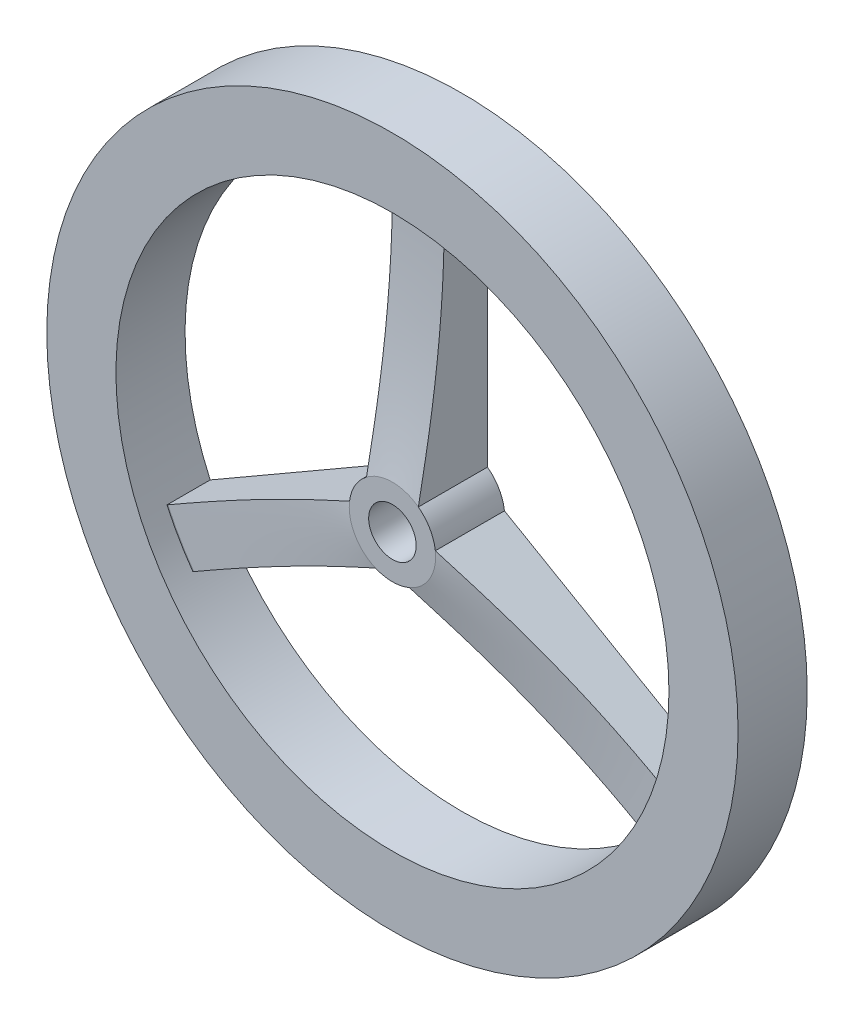
from build123d import *
from build123d.topology import SkipClean

# Parameters (mm, degrees)
SKETCH1_R            = 40
SKETCH1_R_2          = 32
SKETCH1_R_3          = 5
BOSS_EXTRUDE1_DEPTH  = 4
SKETCH3_R            = 32
SKETCH3_R_2          = 5
CUT_EXTRUDE2_DEPTH   = 3
FILLET5_R            = 122
M5_CLEARANCE_HOLE1_D = 5.5


with BuildPart() as part:
    # Sketch1 → Boss-Extrude1 (new, symmetric)
    # profile 1 of 5: a face of its own
    with BuildSketch(Plane.XY):
        Circle(SKETCH1_R)
        Circle(SKETCH1_R_2, mode=Mode.SUBTRACT)
    # profile 2 of 5: a face of its own
    with BuildSketch(Plane.XY):
        with BuildLine():
            Line((-3, 31.859064644), (-3, 4))
            ThreePointArc((-3, 4), (0, 5), (3, 4))
            Line((3, 4), (3, 31.859064644))
            ThreePointArc((3, 31.859064644), (0, 32), (-3, 31.859064644))
        make_face()
    # profile 3 of 5: a face of its own
    with BuildSketch(Plane.XY):
        Circle(SKETCH1_R_3)
    # profile 4 of 5: a face of its own
    with BuildSketch(Plane.XY):
        with BuildLine():
            Line((29.090759323, -13.331456111), (4.964101615, 0.598076211))
            ThreePointArc((4.964101615, 0.598076211), (4.991017335, 0.299576304), (5, 0))
            ThreePointArc((5, 0), (4.172559651, -2.754949357), (1.964101615, -4.598076211))
            Line((1.964101615, -4.598076211), (26.090759323, -18.527608533))
            ThreePointArc((26.090759323, -18.527608533), (27.712812921, -16), (29.090759323, -13.331456111))
        make_face()
    # profile 5 of 5: a face of its own
    with BuildSketch(Plane.XY):
        with BuildLine():
            ThreePointArc((-1.964101615, -4.598076211), (-4.330127019, -2.5), (-4.964101615, 0.598076211))
            Line((-4.964101615, 0.598076211), (-29.090759323, -13.331456111))
            ThreePointArc((-29.090759323, -13.331456111), (-27.712812921, -16), (-26.090759323, -18.527608533))
            Line((-26.090759323, -18.527608533), (-1.964101615, -4.598076211))
        make_face()
    extrude(amount=BOSS_EXTRUDE1_DEPTH, both=True)

    # Sketch3 → Cut-Extrude2 (cut)
    with SkipClean():  # the faces are left unmerged after this step: merging them gives an invalid solid
        with BuildSketch(Plane.XY.offset(4)):
            with Locations(Location((0, 0, 0), (0, 0, 204.620621009))):
                Circle(SKETCH3_R)
            with Locations(Location((0, 0, 0), (0, 0, 173.130102354))):
                Circle(SKETCH3_R_2, mode=Mode.SUBTRACT)
        extrude(amount=-CUT_EXTRUDE2_DEPTH, mode=Mode.SUBTRACT)

    # Fillet5
    # the kernel refuses this fillet: 122 mm, written as the material it adds along each edge
    with BuildSketch(Plane(origin=(0, 0, 1), x_dir=(0.8644503363816339, 0.5027182271707281, 0), z_dir=(0.5027182271707281, -0.8644503363816339, 0))) as fillet5_piece_1_section:
        with BuildLine():
            CenterArc((31.888659319, 122), FILLET5_R, 257.267539737, 12.732460263)
            Line((31.888659319, 0), (5, 0))
            Line((5, 0), (5, 3))
        make_face()
    fillet5_piece_1 = revolve(axis=Axis((0, 0, 1), (0, 0, 1)), revolution_arc=359.64, mode=Mode.PRIVATE)
    fillet5_piece_1 = split(fillet5_piece_1, bisect_by=Plane(origin=(3, 0, 1), z_dir=(-1, 0, 0)), keep=Keep.TOP, mode=Mode.PRIVATE)
    fillet5_piece_1 = split(fillet5_piece_1, bisect_by=Plane(origin=(-1.5, 2.598076211, 1), z_dir=(0.5000000000000004, -0.8660254037844384, 0)), keep=Keep.TOP, mode=Mode.PRIVATE)
    fillet5_piece_1 = split(fillet5_piece_1, bisect_by=Plane(origin=(-1.5, -2.598076211, 1), z_dir=(0.49999999999999983, 0.8660254037844387, 0)), keep=Keep.TOP, mode=Mode.PRIVATE)
    add(fillet5_piece_1)
    with BuildSketch(Plane(origin=(0, 0, 1), x_dir=(0.8644503363816339, 0.5027182271707281, 0), z_dir=(0.5027182271707281, -0.8644503363816339, 0))) as fillet5_piece_2_section:
        with BuildLine():
            CenterArc((31.888659319, 122), FILLET5_R, 257.267539737, 12.732460263)
            Line((31.888659319, 0), (5, 0))
            Line((5, 0), (5, 3))
        make_face()
    fillet5_piece_2 = revolve(axis=Axis((0, 0, 1), (0, 0, 1)), revolution_arc=359.64, mode=Mode.PRIVATE)
    fillet5_piece_2 = split(fillet5_piece_2, bisect_by=Plane(origin=(3, 0, 1), z_dir=(-1, 0, 0)), keep=Keep.TOP, mode=Mode.PRIVATE)
    fillet5_piece_2 = split(fillet5_piece_2, bisect_by=Plane(origin=(-3, 0, 1), z_dir=(1, 0, 0)), keep=Keep.TOP, mode=Mode.PRIVATE)
    fillet5_piece_2 = split(fillet5_piece_2, bisect_by=Plane(origin=(1.5, -2.598076211, 1), z_dir=(-0.5000000000000003, 0.8660254037844385, 0)), keep=Keep.TOP, mode=Mode.PRIVATE)
    add(fillet5_piece_2)
    with BuildSketch(Plane(origin=(0, 0, 1), x_dir=(0.8644503363816339, 0.5027182271707281, 0), z_dir=(0.5027182271707281, -0.8644503363816339, 0))) as fillet5_piece_3_section:
        with BuildLine():
            CenterArc((31.888659319, 122), FILLET5_R, 257.267539737, 12.732460263)
            Line((31.888659319, 0), (5, 0))
            Line((5, 0), (5, 3))
        make_face()
    fillet5_piece_3 = revolve(axis=Axis((0, 0, 1), (0, 0, 1)), revolution_arc=359.64, mode=Mode.PRIVATE)
    fillet5_piece_3 = split(fillet5_piece_3, bisect_by=Plane(origin=(1.5, 2.598076211, 1), z_dir=(-0.49999999999999983, -0.8660254037844387, 0)), keep=Keep.TOP, mode=Mode.PRIVATE)
    fillet5_piece_3 = split(fillet5_piece_3, bisect_by=Plane(origin=(-1.5, 2.598076211, 1), z_dir=(0.5000000000000004, -0.8660254037844384, 0)), keep=Keep.TOP, mode=Mode.PRIVATE)
    fillet5_piece_3 = split(fillet5_piece_3, bisect_by=Plane(origin=(1.5, -2.598076211, 1), z_dir=(-0.5000000000000003, 0.8660254037844385, 0)), keep=Keep.TOP, mode=Mode.PRIVATE)
    add(fillet5_piece_3)
    with BuildSketch(Plane(origin=(0, 0, 1), x_dir=(0.8644503363816339, 0.5027182271707281, 0), z_dir=(0.5027182271707281, -0.8644503363816339, 0))) as fillet5_piece_4_section:
        with BuildLine():
            CenterArc((31.888659319, 122), FILLET5_R, 257.267539737, 12.732460263)
            Line((31.888659319, 0), (5, 0))
            Line((5, 0), (5, 3))
        make_face()
    fillet5_piece_4 = revolve(axis=Axis((0, 0, 1), (0, 0, 1)), revolution_arc=359.64, mode=Mode.PRIVATE)
    fillet5_piece_4 = split(fillet5_piece_4, bisect_by=Plane(origin=(1.5, 2.598076211, 1), z_dir=(-0.49999999999999983, -0.8660254037844387, 0)), keep=Keep.TOP, mode=Mode.PRIVATE)
    fillet5_piece_4 = split(fillet5_piece_4, bisect_by=Plane(origin=(1.5, -2.598076211, 1), z_dir=(0.5000000000000003, -0.8660254037844385, 0)), keep=Keep.TOP, mode=Mode.PRIVATE)
    fillet5_piece_4 = split(fillet5_piece_4, bisect_by=Plane(origin=(-1.5, -2.598076211, 1), z_dir=(0.49999999999999983, 0.8660254037844387, 0)), keep=Keep.TOP, mode=Mode.PRIVATE)
    add(fillet5_piece_4)
    with BuildSketch(Plane(origin=(0, 0, 1), x_dir=(-0.8675919238668259, 0.4972768380299447, 0), z_dir=(0.4972768380299447, 0.8675919238668259, 0))) as fillet5_piece_5_section:
        with BuildLine():
            CenterArc((31.888659319, 122), FILLET5_R, 257.267539737, 12.732460263)
            Line((31.888659319, 0), (5, 0))
            Line((5, 0), (5, 3))
        make_face()
    fillet5_piece_5 = revolve(axis=Axis((0, 0, 1), (0, 0, 1)), revolution_arc=359.64, mode=Mode.PRIVATE)
    fillet5_piece_5 = split(fillet5_piece_5, bisect_by=Plane(origin=(1.5, 2.598076211, 1), z_dir=(-0.49999999999999983, -0.8660254037844387, 0)), keep=Keep.TOP, mode=Mode.PRIVATE)
    fillet5_piece_5 = split(fillet5_piece_5, bisect_by=Plane(origin=(-1.5, 2.598076211, 1), z_dir=(0.5000000000000004, -0.8660254037844384, 0)), keep=Keep.TOP, mode=Mode.PRIVATE)
    fillet5_piece_5 = split(fillet5_piece_5, bisect_by=Plane(origin=(-1.5, -2.598076211, 1), z_dir=(0.49999999999999983, 0.8660254037844387, 0)), keep=Keep.TOP, mode=Mode.PRIVATE)
    add(fillet5_piece_5)
    with BuildSketch(Plane(origin=(0, 0, 1), x_dir=(-0.8675919238668259, 0.4972768380299447, 0), z_dir=(0.4972768380299447, 0.8675919238668259, 0))) as fillet5_piece_6_section:
        with BuildLine():
            CenterArc((31.888659319, 122), FILLET5_R, 257.267539737, 12.732460263)
            Line((31.888659319, 0), (5, 0))
            Line((5, 0), (5, 3))
        make_face()
    fillet5_piece_6 = revolve(axis=Axis((0, 0, 1), (0, 0, 1)), revolution_arc=359.64, mode=Mode.PRIVATE)
    fillet5_piece_6 = split(fillet5_piece_6, bisect_by=Plane(origin=(3, 0, 1), z_dir=(-1, 0, 0)), keep=Keep.TOP, mode=Mode.PRIVATE)
    fillet5_piece_6 = split(fillet5_piece_6, bisect_by=Plane(origin=(-1.5, 2.598076211, 1), z_dir=(0.5000000000000004, -0.8660254037844384, 0)), keep=Keep.TOP, mode=Mode.PRIVATE)
    fillet5_piece_6 = split(fillet5_piece_6, bisect_by=Plane(origin=(1.5, -2.598076211, 1), z_dir=(-0.5000000000000003, 0.8660254037844385, 0)), keep=Keep.TOP, mode=Mode.PRIVATE)
    add(fillet5_piece_6)
    with BuildSketch(Plane(origin=(0, 0, 1), x_dir=(-0.8675919238668259, 0.4972768380299447, 0), z_dir=(0.4972768380299447, 0.8675919238668259, 0))) as fillet5_piece_7_section:
        with BuildLine():
            CenterArc((31.888659319, 122), FILLET5_R, 257.267539737, 12.732460263)
            Line((31.888659319, 0), (5, 0))
            Line((5, 0), (5, 3))
        make_face()
    fillet5_piece_7 = revolve(axis=Axis((0, 0, 1), (0, 0, 1)), revolution_arc=359.64, mode=Mode.PRIVATE)
    fillet5_piece_7 = split(fillet5_piece_7, bisect_by=Plane(origin=(3, 0, 1), z_dir=(-1, 0, 0)), keep=Keep.TOP, mode=Mode.PRIVATE)
    fillet5_piece_7 = split(fillet5_piece_7, bisect_by=Plane(origin=(-3, 0, 1), z_dir=(1, 0, 0)), keep=Keep.TOP, mode=Mode.PRIVATE)
    fillet5_piece_7 = split(fillet5_piece_7, bisect_by=Plane(origin=(-1.5, -2.598076211, 1), z_dir=(0.49999999999999983, 0.8660254037844387, 0)), keep=Keep.TOP, mode=Mode.PRIVATE)
    add(fillet5_piece_7)
    with BuildSketch(Plane(origin=(0, 0, 1), x_dir=(0.0031415874858787157, -0.9999950652018581, 0), z_dir=(-0.9999950652018581, -0.0031415874858787157, 0))) as fillet5_piece_8_section:
        with BuildLine():
            CenterArc((31.888659319, 122), FILLET5_R, 257.267539737, 12.732460263)
            Line((31.888659319, 0), (5, 0))
            Line((5, 0), (5, 3))
        make_face()
    fillet5_piece_8 = revolve(axis=Axis((0, 0, 1), (0, 0, 1)), revolution_arc=359.64, mode=Mode.PRIVATE)
    fillet5_piece_8 = split(fillet5_piece_8, bisect_by=Plane(origin=(1.5, 2.598076211, 1), z_dir=(-0.49999999999999983, -0.8660254037844387, 0)), keep=Keep.TOP, mode=Mode.PRIVATE)
    fillet5_piece_8 = split(fillet5_piece_8, bisect_by=Plane(origin=(-1.5, 2.598076211, 1), z_dir=(0.5000000000000004, -0.8660254037844384, 0)), keep=Keep.TOP, mode=Mode.PRIVATE)
    fillet5_piece_8 = split(fillet5_piece_8, bisect_by=Plane(origin=(-1.5, -2.598076211, 1), z_dir=(0.49999999999999983, 0.8660254037844387, 0)), keep=Keep.TOP, mode=Mode.PRIVATE)
    add(fillet5_piece_8)
    with BuildSketch(Plane(origin=(0, 0, 1), x_dir=(0.0031415874858787157, -0.9999950652018581, 0), z_dir=(-0.9999950652018581, -0.0031415874858787157, 0))) as fillet5_piece_9_section:
        with BuildLine():
            CenterArc((31.888659319, 122), FILLET5_R, 257.267539737, 12.732460263)
            Line((31.888659319, 0), (5, 0))
            Line((5, 0), (5, 3))
        make_face()
    fillet5_piece_9 = revolve(axis=Axis((0, 0, 1), (0, 0, 1)), revolution_arc=359.64, mode=Mode.PRIVATE)
    fillet5_piece_9 = split(fillet5_piece_9, bisect_by=Plane(origin=(3, 0, 1), z_dir=(-1, 0, 0)), keep=Keep.TOP, mode=Mode.PRIVATE)
    fillet5_piece_9 = split(fillet5_piece_9, bisect_by=Plane(origin=(-3, 0, 1), z_dir=(1, 0, 0)), keep=Keep.TOP, mode=Mode.PRIVATE)
    fillet5_piece_9 = split(fillet5_piece_9, bisect_by=Plane(origin=(1.5, -2.598076211, 1), z_dir=(-0.5000000000000003, 0.8660254037844385, 0)), keep=Keep.TOP, mode=Mode.PRIVATE)
    add(fillet5_piece_9)
    with BuildSketch(Plane(origin=(0, 0, 1), x_dir=(0.0031415874858787157, -0.9999950652018581, 0), z_dir=(-0.9999950652018581, -0.0031415874858787157, 0))) as fillet5_piece_10_section:
        with BuildLine():
            CenterArc((31.888659319, 122), FILLET5_R, 257.267539737, 12.732460263)
            Line((31.888659319, 0), (5, 0))
            Line((5, 0), (5, 3))
        make_face()
    fillet5_piece_10 = revolve(axis=Axis((0, 0, 1), (0, 0, 1)), revolution_arc=359.64, mode=Mode.PRIVATE)
    fillet5_piece_10 = split(fillet5_piece_10, bisect_by=Plane(origin=(-1.5, 2.598076211, 1), z_dir=(0.5000000000000004, -0.8660254037844384, 0)), keep=Keep.TOP, mode=Mode.PRIVATE)
    fillet5_piece_10 = split(fillet5_piece_10, bisect_by=Plane(origin=(1.5, -2.598076211, 1), z_dir=(-0.5000000000000003, 0.8660254037844385, 0)), keep=Keep.TOP, mode=Mode.PRIVATE)
    fillet5_piece_10 = split(fillet5_piece_10, bisect_by=Plane(origin=(-1.5, -2.598076211, 1), z_dir=(-0.49999999999999983, -0.8660254037844387, 0)), keep=Keep.TOP, mode=Mode.PRIVATE)
    add(fillet5_piece_10)

    # M5 Clearance Hole1 (through all)
    with Locations(Plane.XY.offset(4)):
        with Locations((0, 0)):
            Hole(M5_CLEARANCE_HOLE1_D / 2)


solid = part.part
